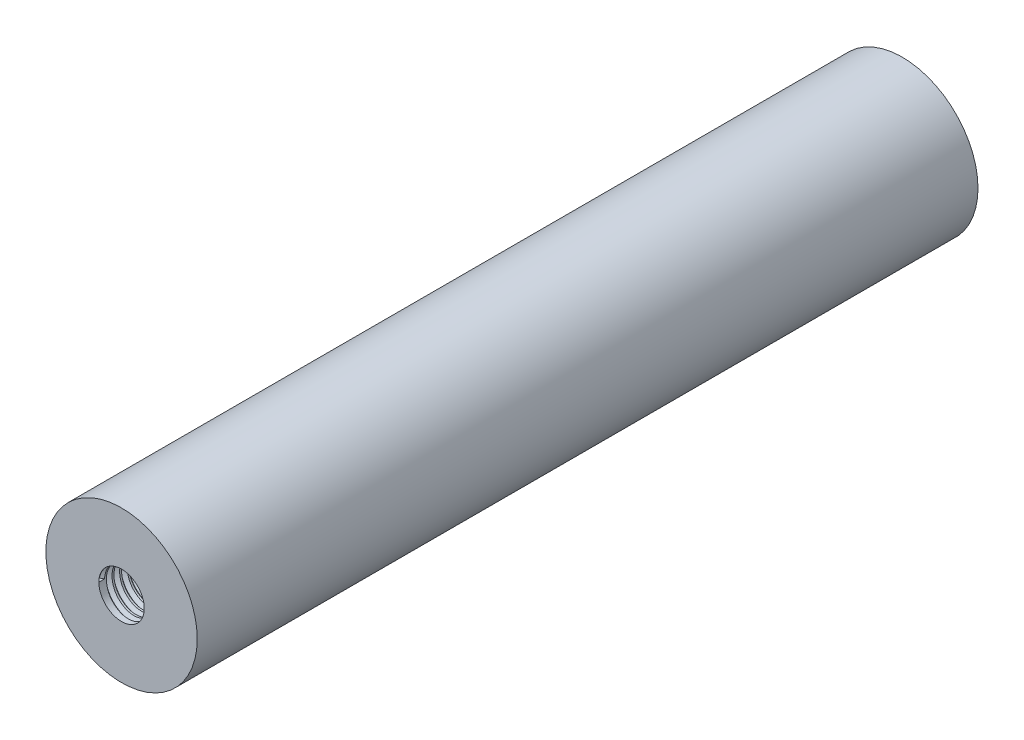
from build123d import *
from build123d.topology import SkipClean

# Parameters (mm, degrees)
SKETCH1_R           = 10
BOSS_EXTRUDE1_DEPTH = 59.145
CUT_EXTRUDE2_START  = 44
SKETCH5_W           = 61.698444424
SKETCH5_H           = 74.597655154
CUT_EXTRUDE2_DEPTH  = 112
SKETCH6_R           = 3
CUT_EXTRUDE3_DEPTH  = 10
THREAD1_PITCH       = 1
CUT_EXTRUDE4_START  = -10
SKETCH8_R           = 3
CUT_EXTRUDE4_DEPTH  = 10
THREAD2_PITCH       = 1


with BuildPart() as part:
    # Sketch1 → Boss-Extrude1 (new, symmetric)
    with BuildSketch(Plane.XY):
        Circle(SKETCH1_R)
    extrude(amount=BOSS_EXTRUDE1_DEPTH, both=True)

    # Sketch5 → Cut-Extrude2 (cut)
    with BuildSketch(Plane.XY.offset(CUT_EXTRUDE2_START)):
        Rectangle(SKETCH5_W, SKETCH5_H)
    extrude(amount=CUT_EXTRUDE2_DEPTH, mode=Mode.SUBTRACT)

    # Sketch6 → Cut-Extrude3 (cut)
    with BuildSketch(Plane.XY.offset(44)):
        Circle(SKETCH6_R)
    extrude(amount=-CUT_EXTRUDE3_DEPTH, mode=Mode.SUBTRACT)

    # Thread1: the profile of Thread Profile1 profile screwed along a right-hand helix of 10 turns, 8 arcs to a turn; built about Z, then put on its axis
    with SkipClean():  # the faces are left unmerged after this step: merging them gives an invalid solid
        thread1_z = Axis((0, 0, 0), (0, 0, 1))
        thread1_corners = [(2.9997, 0, -0.000173205), (3.541265875, 0, 0.312499999), (3.541265875, 0, 0.437499999), (2.9997, 0, 0.750173202)]
        with BuildLine(mode=Mode.PRIVATE) as thread1_profile:
            Line(thread1_corners[0], thread1_corners[1])
            Line(thread1_corners[1], thread1_corners[2])
            Line(thread1_corners[2], thread1_corners[3])
            Line(thread1_corners[3], thread1_corners[0])
        thread1_cap = Face(thread1_profile.wire())
        thread1_turn_angles = [0, 22.5, 45, 67.5, 90, 112.5, 135, 157.5, 180, 202.5, 225, 247.5, 270, 292.5, 315, 337.5, 360]
        thread1_turn_weights = [1, 0.9238795325112867, 1, 0.9238795325112867, 1, 0.9238795325112867, 1, 0.9238795325112867, 1, 0.9238795325112867, 1, 0.9238795325112867, 1, 0.9238795325112867, 1, 0.9238795325112867, 1]
        thread1_turn_rails = [Edge.make_bspline([Vector(p[0], p[1], 0).rotate(thread1_z, thread1_turn_angles[k]) / thread1_turn_weights[k] + Vector(0, 0, p[2] + THREAD1_PITCH * thread1_turn_angles[k] / 360) for k in range(17)], [0, 0, 0, 1, 1, 2, 2, 3, 3, 4, 4, 5, 5, 6, 6, 7, 7, 8, 8, 8], 2, thread1_turn_weights) for p in thread1_corners]
        thread1_turn_sides = [Face.make_surface_from_curves(thread1_turn_rails[p[0]], thread1_turn_rails[p[1]]) for p in [(0, 1), (1, 2), (2, 3), (3, 0)]]
        thread1 = Plane(origin=(0, 0, 44), x_dir=(-1, 0, 0), z_dir=(0, 0, -1)) * Solid(Shell([*[p.moved(Location((0, 0, THREAD1_PITCH * i))) for i in range(10) for p in thread1_turn_sides], thread1_cap, thread1_cap.rotate(thread1_z, 3600).moved(Location((0, 0, THREAD1_PITCH * 3600 / 360)))]))
        add(thread1, mode=Mode.SUBTRACT)

    # Sketch8 → Cut-Extrude4 (cut)
    with SkipClean():  # the faces are left unmerged after this step: merging them gives an invalid solid
        with BuildSketch(Plane(origin=(0, 0, -59.145), x_dir=(-1, 0, 0), z_dir=(0, 0, -1)).offset(CUT_EXTRUDE4_START)):
            Circle(SKETCH8_R)
        extrude(amount=CUT_EXTRUDE4_DEPTH, mode=Mode.SUBTRACT)

    # Thread2: the profile of Thread Profile2 profile screwed along a right-hand helix of 10 turns, 8 arcs to a turn; built about Z, then put on its axis
    with SkipClean():  # the faces are left unmerged after this step: merging them gives an invalid solid
        thread2_z = Axis((0, 0, 0), (0, 0, 1))
        thread2_corners = [(2.9997, 0, -0.000173205), (3.541265875, 0, 0.312499999), (3.541265875, 0, 0.437499999), (2.9997, 0, 0.750173202)]
        with BuildLine(mode=Mode.PRIVATE) as thread2_profile:
            Line(thread2_corners[0], thread2_corners[1])
            Line(thread2_corners[1], thread2_corners[2])
            Line(thread2_corners[2], thread2_corners[3])
            Line(thread2_corners[3], thread2_corners[0])
        thread2_cap = Face(thread2_profile.wire())
        thread2_turn_angles = [0, 22.5, 45, 67.5, 90, 112.5, 135, 157.5, 180, 202.5, 225, 247.5, 270, 292.5, 315, 337.5, 360]
        thread2_turn_weights = [1, 0.9238795325112867, 1, 0.9238795325112867, 1, 0.9238795325112867, 1, 0.9238795325112867, 1, 0.9238795325112867, 1, 0.9238795325112867, 1, 0.9238795325112867, 1, 0.9238795325112867, 1]
        thread2_turn_rails = [Edge.make_bspline([Vector(p[0], p[1], 0).rotate(thread2_z, thread2_turn_angles[k]) / thread2_turn_weights[k] + Vector(0, 0, p[2] + THREAD2_PITCH * thread2_turn_angles[k] / 360) for k in range(17)], [0, 0, 0, 1, 1, 2, 2, 3, 3, 4, 4, 5, 5, 6, 6, 7, 7, 8, 8, 8], 2, thread2_turn_weights) for p in thread2_corners]
        thread2_turn_sides = [Face.make_surface_from_curves(thread2_turn_rails[p[0]], thread2_turn_rails[p[1]]) for p in [(0, 1), (1, 2), (2, 3), (3, 0)]]
        thread2 = Plane(origin=(0, 0, -59.145), x_dir=(1, 0, 0), z_dir=(0, 0, 1)) * Solid(Shell([*[p.moved(Location((0, 0, THREAD2_PITCH * i))) for i in range(10) for p in thread2_turn_sides], thread2_cap, thread2_cap.rotate(thread2_z, 3600).moved(Location((0, 0, THREAD2_PITCH * 3600 / 360)))]))
        add(thread2, mode=Mode.SUBTRACT)


solid = part.part
